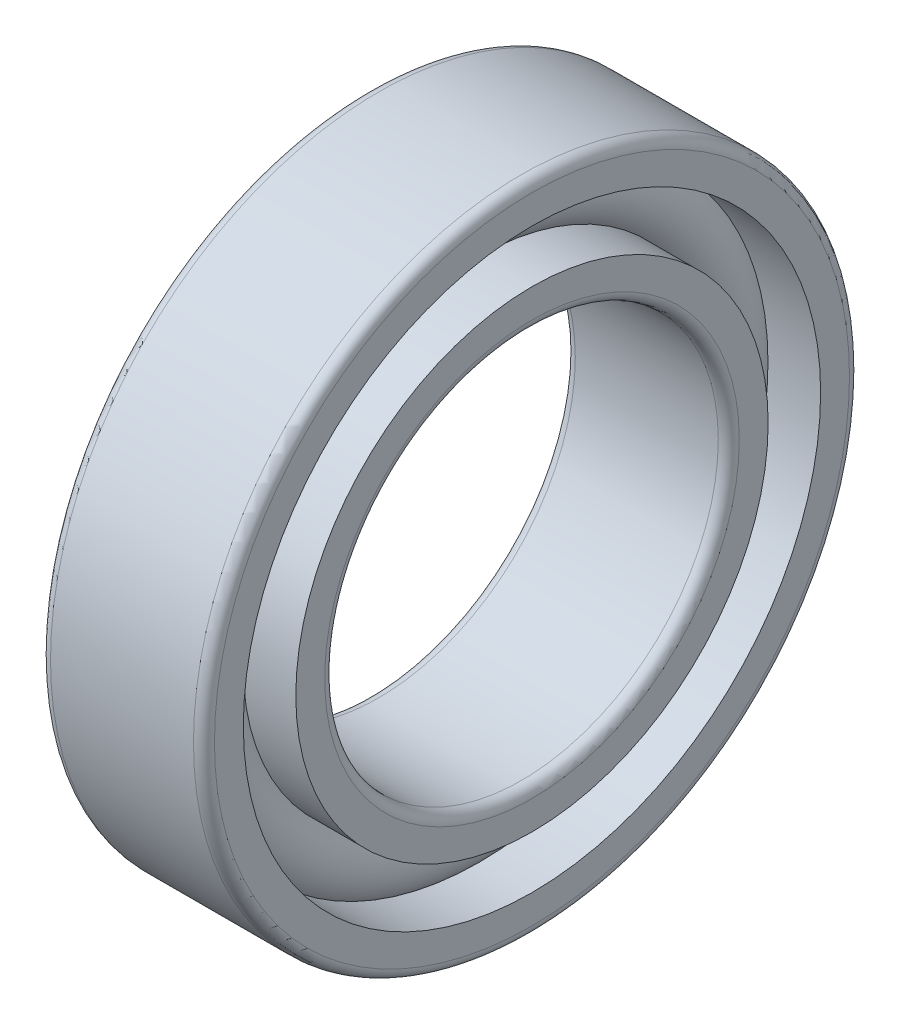
from build123d import *

# Parameters (mm, degrees)
CAGSPISKE_W     = 0.1905
CAGSPISKE_H     = 0.3175
CAGESPINE_ANGLE = 0.001
BALSIMSKE_R     = 0.9525


with BuildPart() as part:
    # CagSpiSke → CageSpine (revolve)
    with BuildSketch(Plane.XY):
        with Locations((0, 6.35)):
            Rectangle(CAGSPISKE_W, CAGSPISKE_H)
    revolve(axis=Axis((-20.6375, 0, 0), (-1, 0, 0)), revolution_arc=CAGESPINE_ANGLE)

    # BalSimSke → BallsSimplified (revolve)
    with BuildSketch(Plane.XY):
        with Locations((0, 6.35)):
            Circle(BALSIMSKE_R)
    revolve(axis=Axis((-10, 0, 0), (1, 0, 0)))

    # InnRacSke → InnerRace (revolve)
    with BuildSketch(Plane.XY):
        with BuildLine():
            Line((-0.650091976, 5.715), (-1.98374, 5.715))
            Line((-1.98374, 5.715), (-1.98374, 5.0165))
            ThreePointArc((-1.98374, 5.0165), (-1.909345122, 4.836894878), (-1.72974, 4.7625))
            Line((-1.72974, 4.7625), (1.72974, 4.7625))
            ThreePointArc((1.72974, 4.7625), (1.909345122, 4.836894878), (1.98374, 5.0165))
            Line((1.98374, 5.0165), (1.98374, 5.715))
            Line((1.98374, 5.715), (0.700891976, 5.715))
            ThreePointArc((0.700891976, 5.715), (0.0254, 5.4229), (-0.650091976, 5.715))
        make_face()
    revolve(axis=Axis((-20.6375, 0, 0), (1, 0, 0)))

    # OutRacSke → OuterRace (revolve)
    with BuildSketch(Plane.XY):
        with BuildLine():
            Line((-0.675491976, 6.985), (-1.98374, 6.985))
            Line((-1.98374, 6.985), (-1.98374, 7.6835))
            ThreePointArc((-1.98374, 7.6835), (-1.909345122, 7.863105122), (-1.72974, 7.9375))
            Line((-1.72974, 7.9375), (1.72974, 7.9375))
            ThreePointArc((1.72974, 7.9375), (1.909345122, 7.863105122), (1.98374, 7.6835))
            Line((1.98374, 7.6835), (1.98374, 6.985))
            Line((1.98374, 6.985), (0.675491976, 6.985))
            ThreePointArc((0.675491976, 6.985), (0, 7.2771), (-0.675491976, 6.985))
        make_face()
    revolve(axis=Axis((-20.6375, 0, 0), (1, 0, 0)))


solid = part.part
